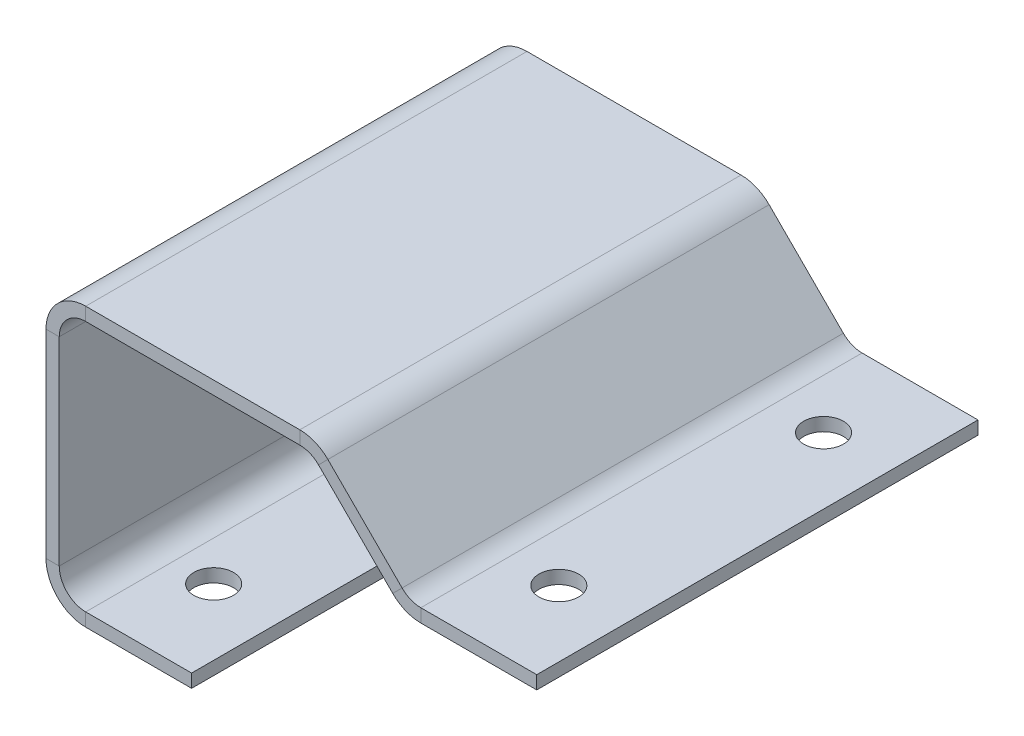
from build123d import *

# Parameters (mm, degrees)
SKETCH1_W                    = 15
SKETCH1_H                    = 50
SKETCH1_R                    = 2.25
BASE_FLANGE1_DEPTH           = 1.5
EDGE_FLANGE1_STRIP_W         = 12
EDGE_FLANGE1_STRIP_H         = 1.5
EDGE_FLANGE1_STRIP_CUT_DEPTH = 50
EDGE_FLANGE1_DEPTH           = 50
EDGE_FLANGE2_STRIP_W         = 12
EDGE_FLANGE2_STRIP_H         = 1.5
EDGE_FLANGE2_STRIP_CUT_DEPTH = 50
EDGE_FLANGE2_DEPTH           = 50
EDGE_FLANGE3_STRIP_CUT_DEPTH = 50
EDGE_FLANGE3_DEPTH           = 50
EDGE_FLANGE4_STRIP_CUT_DEPTH = 50
EDGE_FLANGE4_DEPTH           = 50
SKETCH19_R                   = 2.25
CUT_EXTRUDE1_DEPTH           = 57.865713883


# Sheet-metal steps are written as plain solids
with BuildPart() as part:
    # Sketch1 → Base-Flange1 (new body)
    with BuildSketch(Plane(origin=(0, 0, 0), x_dir=(1, 0, 0), z_dir=(0, 1, 0))):
        Rectangle(SKETCH1_W, SKETCH1_H)
        with Locations(Location((0, 15, 0), (0, 0, 270))):
            Circle(SKETCH1_R, mode=Mode.SUBTRACT)
        with Locations(Location((0, -15, 0), (0, 0, 270))):
            Circle(SKETCH1_R, mode=Mode.SUBTRACT)
    extrude(amount=BASE_FLANGE1_DEPTH)

    # Edge-Flange1 strip (across the edge) → Edge-Flange1 strip cut (cut)
    with BuildSketch(Plane(origin=(-7.5, 1.5, -25), x_dir=(1, 0, 0), z_dir=(0, 0, 1))):
        with Locations((-3, -0.75)):
            Rectangle(EDGE_FLANGE1_STRIP_W, EDGE_FLANGE1_STRIP_H)
    extrude(amount=EDGE_FLANGE1_STRIP_CUT_DEPTH, mode=Mode.SUBTRACT)

    # Edge-Flange1 section (across the edge) → Edge-Flange1 (add)
    with BuildSketch(Plane(origin=(-7.5, 1.5, -25), x_dir=(1, 0, 0), z_dir=(0, 0, 1))):
        with BuildLine():
            Line((-1.5, 3), (-1.5, 28.5))
            Line((-1.5, 28.5), (0, 28.5))
            Line((0, 28.5), (0, 3))
            ThreePointArc((0, 3), (0.878679656, 0.878679656), (3, 0))
            Line((3, 0), (3, -1.5))
            ThreePointArc((3, -1.5), (-0.181980515, -0.181980515), (-1.5, 3))
        make_face()
    extrude(amount=EDGE_FLANGE1_DEPTH)

    # Edge-Flange2 strip (across the edge) → Edge-Flange2 strip cut (cut)
    with BuildSketch(Plane(origin=(-7.5, 30, -25), x_dir=(0, -1, 0), z_dir=(0, 0, 1))):
        with Locations((-3, -0.75)):
            Rectangle(EDGE_FLANGE2_STRIP_W, EDGE_FLANGE2_STRIP_H)
    extrude(amount=EDGE_FLANGE2_STRIP_CUT_DEPTH, mode=Mode.SUBTRACT)

    # Edge-Flange2 section (across the edge) → Edge-Flange2 (add)
    with BuildSketch(Plane(origin=(-7.5, 30, -25), x_dir=(0, -1, 0), z_dir=(0, 0, 1))):
        with BuildLine():
            Line((-1.5, 3), (-1.5, 28.5))
            Line((-1.5, 28.5), (0, 28.5))
            Line((0, 28.5), (0, 3))
            ThreePointArc((0, 3), (0.878679656, 0.878679656), (3, 0))
            Line((3, 0), (3, -1.5))
            ThreePointArc((3, -1.5), (-0.181980515, -0.181980515), (-1.5, 3))
        make_face()
    extrude(amount=EDGE_FLANGE2_DEPTH)

    # Edge-Flange3 strip (across the edge) → Edge-Flange3 strip cut (cut)
    with BuildSketch(Plane(origin=(21, 30, -25), x_dir=(-0.7071067811865389, -0.7071067811865561, 0), z_dir=(0, 0, 1))):
        Polygon((-8.66726189, 6.545941546), (-0.181980515, -1.939339828), (0.878679656, -0.878679656), (-7.606601718, 7.606601718), align=None)
    extrude(amount=EDGE_FLANGE3_STRIP_CUT_DEPTH, mode=Mode.SUBTRACT)

    # Edge-Flange3 section (across the edge) → Edge-Flange3 (add)
    with BuildSketch(Plane(origin=(21, 30, -25), x_dir=(-0.7071067811865389, -0.7071067811865561, 0), z_dir=(0, 0, 1))):
        with BuildLine():
            Line((-1.5, 1.242640687), (-1.5, 14.378679656))
            Line((-1.5, 14.378679656), (0, 14.378679656))
            Line((0, 14.378679656), (0, 1.242640687))
            ThreePointArc((0, 1.242640687), (0.228361402, 0.09459039), (0.878679656, -0.878679656))
            Line((0.878679656, -0.878679656), (-0.181980515, -1.939339828))
            ThreePointArc((-0.181980515, -1.939339828), (-1.157457896, -0.479434759), (-1.5, 1.242640687))
        make_face()
    extrude(amount=EDGE_FLANGE3_DEPTH)

    # Edge-Flange4 strip (across the edge) → Edge-Flange4 strip cut (cut)
    with BuildSketch(Plane(origin=(32.227922061, 20.893398282, 25), x_dir=(0, 1, 0), z_dir=(0, 0, -1))):
        Polygon((-8.66726189, 6.545941546), (-0.181980515, -1.939339828), (0.878679656, -0.878679656), (-7.606601718, 7.606601718), align=None)
    extrude(amount=EDGE_FLANGE4_STRIP_CUT_DEPTH, mode=Mode.SUBTRACT)

    # Edge-Flange4 section (across the edge) → Edge-Flange4 (add)
    with BuildSketch(Plane(origin=(32.227922061, 20.893398282, 25), x_dir=(0, 1, 0), z_dir=(0, 0, -1))):
        with BuildLine():
            Line((-1.5, 1.242640687), (-1.5, 14.378679656))
            Line((-1.5, 14.378679656), (0, 14.378679656))
            Line((0, 14.378679656), (0, 1.242640687))
            ThreePointArc((0, 1.242640687), (0.228361402, 0.09459039), (0.878679656, -0.878679656))
            Line((0.878679656, -0.878679656), (-0.181980515, -1.939339828))
            ThreePointArc((-0.181980515, -1.939339828), (-1.157457896, -0.479434759), (-1.5, 1.242640687))
        make_face()
    extrude(amount=EDGE_FLANGE4_DEPTH)

    # Sketch19 → Cut-Extrude1 (cut, through all)
    with BuildSketch(Plane(origin=(0, 20.893398282, 0), x_dir=(1, 0, 0), z_dir=(0, 1, 0))):
        with Locations(Location((39.106601718, 15, 0), (0, 0, 180))):
            Circle(SKETCH19_R)
        with Locations(Location((39.106601718, -15, 0), (0, 0, 180))):
            Circle(SKETCH19_R)
    extrude(amount=-CUT_EXTRUDE1_DEPTH, mode=Mode.SUBTRACT)


solid = part.part
